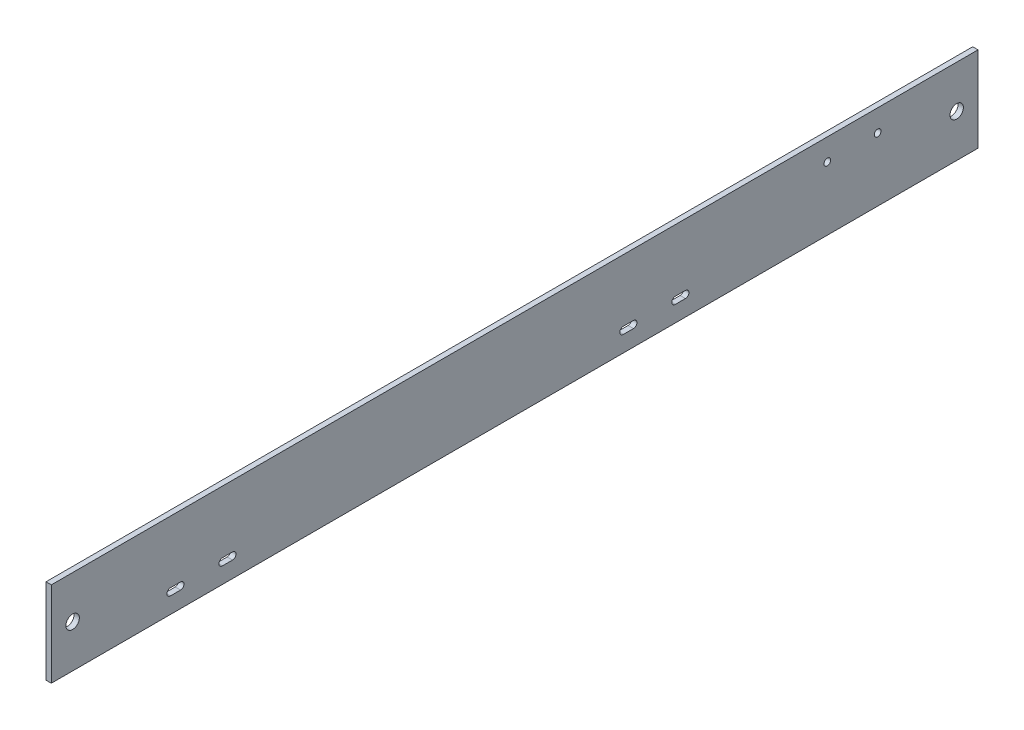
from build123d import *

# Parameters (mm, degrees)
SKETCH1_W           = 552.45
SKETCH1_H           = 50.8
SKETCH1_R           = 4
SKETCH1_R_2         = 2
BOSS_EXTRUDE2_DEPTH = 3.175


with BuildPart() as part:
    # Sketch1 → Boss-Extrude2 (new body)
    with BuildSketch(Plane(origin=(0, 0, 0), x_dir=(0, 0, -1), z_dir=(1, 0, 0))):
        with Locations((276.225, 25.4)):
            Rectangle(SKETCH1_W, SKETCH1_H)
        with Locations((12.7, 25.4)):
            Circle(SKETCH1_R, mode=Mode.SUBTRACT)
        with Locations((539.75, 25.4)):
            Circle(SKETCH1_R, mode=Mode.SUBTRACT)
        with Locations((462.625, 37.8)):
            Circle(SKETCH1_R_2, mode=Mode.SUBTRACT)
        with Locations((492.625, 37.8)):
            Circle(SKETCH1_R_2, mode=Mode.SUBTRACT)
        with BuildLine():
            Line((71.025, 13.8), (77.025, 13.8))
            ThreePointArc((77.025, 13.8), (79.125, 11.7), (77.025, 9.6))
            Line((77.025, 9.6), (71.025, 9.6))
            ThreePointArc((71.025, 9.6), (68.925, 11.7), (71.025, 13.8))
        make_face(mode=Mode.SUBTRACT)
        with BuildLine():
            Line((102.025, 13.8), (108.025, 13.8))
            ThreePointArc((108.025, 13.8), (110.125, 11.7), (108.025, 9.6))
            Line((108.025, 9.6), (102.025, 9.6))
            ThreePointArc((102.025, 9.6), (99.925, 11.7), (102.025, 13.8))
        make_face(mode=Mode.SUBTRACT)
        with BuildLine():
            Line((341.025, 13.8), (347.025, 13.8))
            ThreePointArc((347.025, 13.8), (349.125, 11.7), (347.025, 9.6))
            Line((347.025, 9.6), (341.025, 9.6))
            ThreePointArc((341.025, 9.6), (338.925, 11.7), (341.025, 13.8))
        make_face(mode=Mode.SUBTRACT)
        with BuildLine():
            Line((372.025, 13.8), (378.025, 13.8))
            ThreePointArc((378.025, 13.8), (380.125, 11.7), (378.025, 9.6))
            Line((378.025, 9.6), (372.025, 9.6))
            ThreePointArc((372.025, 9.6), (369.925, 11.7), (372.025, 13.8))
        make_face(mode=Mode.SUBTRACT)
    extrude(amount=BOSS_EXTRUDE2_DEPTH)


solid = part.part
